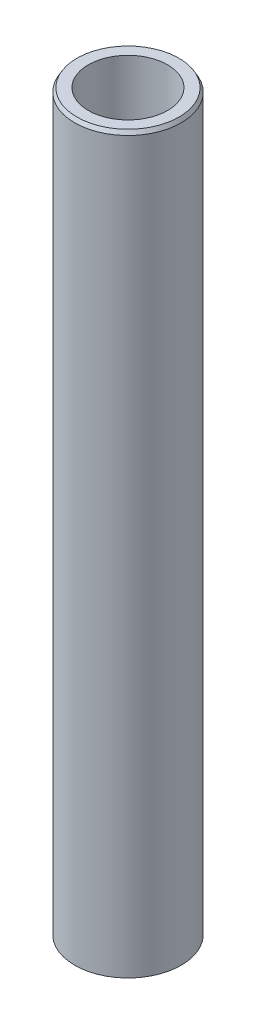
from build123d import *
from OCP.BRepFilletAPI import BRepFilletAPI_MakeChamfer

# Parameters (mm, degrees)
SKETCH1_R           = 37.5
BOSS_EXTRUDE1_DEPTH = 518.320670067
SKETCH2_R           = 27.92417986
CUT_EXTRUDE1_DEPTH  = 522.026695111
CHAMFER1_SIZE       = 2.717814351
CHAMFER1_SIZE2      = 1.569130847


with BuildPart() as part:
    # Sketch1 → Boss-Extrude1 (new body)
    with BuildSketch(Plane(origin=(0, 0, 0), x_dir=(1, 0, 0), z_dir=(0, 1, 0))):
        Circle(SKETCH1_R)
    extrude(amount=BOSS_EXTRUDE1_DEPTH)

    # Sketch2 → Cut-Extrude1 (cut, through all)
    with BuildSketch(Plane(origin=(0, 0, 0), x_dir=(1, 0, 0), z_dir=(0, 1, 0))):
        Circle(SKETCH2_R)
    extrude(amount=CUT_EXTRUDE1_DEPTH, mode=Mode.SUBTRACT)

    # Chamfer1: one chamfer whose edges measure the first distance from different faces: ONE call of the kernel's chamfer builder (chamfer() names one face for all edges)
    chamfer1_edges_1 = [part.edges().sort_by_distance(p)[0] for p in [
        (-37.5, 518.320670067, 0),
    ]]
    chamfer1_side_1 = [part.faces().sort_by_distance(p)[0] for p in [
        (-37.5, 259.160335033, 0),
    ]]
    chamfer1_edges_2 = [part.edges().sort_by_distance(p)[0] for p in [
        (-37.5, 0, 0),
    ]]
    chamfer1_side_2 = [part.faces().sort_by_distance(p)[0] for p in [
        (-36.439339828, 0, 0),
    ]]
    chamfer1 = BRepFilletAPI_MakeChamfer(part.part.solid().wrapped)
    for e in chamfer1_edges_1:
        chamfer1.Add(CHAMFER1_SIZE, CHAMFER1_SIZE2, e.wrapped, chamfer1_side_1[0].wrapped)  # the first distance lies on this face
    for e in chamfer1_edges_2:
        chamfer1.Add(CHAMFER1_SIZE, CHAMFER1_SIZE2, e.wrapped, chamfer1_side_2[0].wrapped)  # the first distance lies on this face
    add(Compound.cast(chamfer1.Shape()), mode=Mode.REPLACE)


solid = part.part
